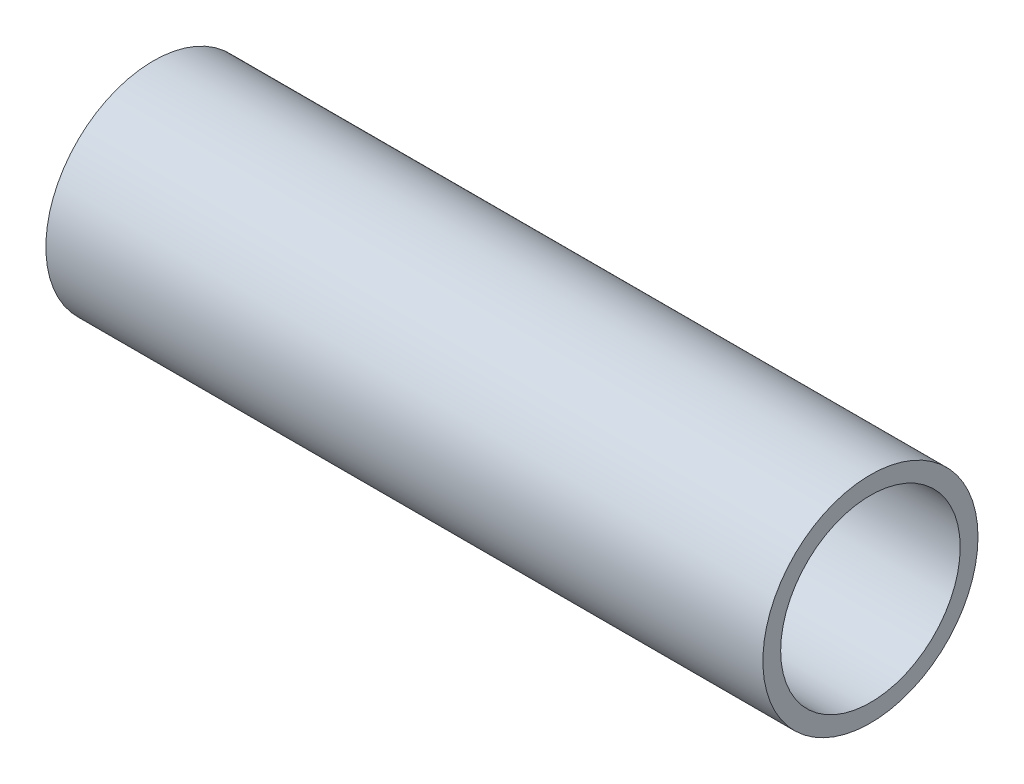
from build123d import *

# Parameters (mm, degrees)
SKETCH1_R           = 4.7625
SKETCH1_R_2         = 3.9751
BOSS_EXTRUDE1_DEPTH = 31.75


with BuildPart() as part:
    # Sketch1 → Boss-Extrude1 (new body)
    with BuildSketch(Plane(origin=(0, 0, 0), x_dir=(0, 0, -1), z_dir=(1, 0, 0))):
        Circle(SKETCH1_R)
        Circle(SKETCH1_R_2, mode=Mode.SUBTRACT)
    extrude(amount=BOSS_EXTRUDE1_DEPTH)


solid = part.part
